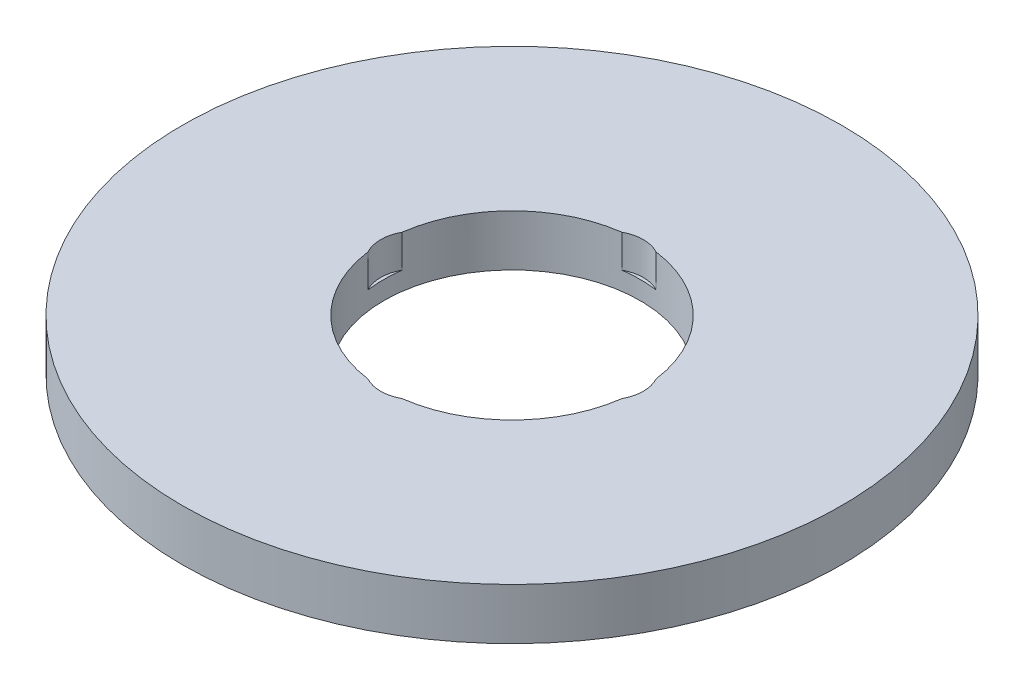
from build123d import *

# Parameters (mm, degrees)
SKETCH1_R           = 90
BOSS_EXTRUDE1_DEPTH = 14
SKETCH2_R           = 35
CUT_EXTRUDE1_DEPTH  = 129.04686642
SKETCH3_R           = 9.872665874
CUT_EXTRUDE2_DEPTH  = 8.971888535
CIRPATTERN1_COUNT   = 4


with BuildPart() as part:
    # Sketch1 → Boss-Extrude1 (new body)
    with BuildSketch(Plane(origin=(0, 0, 0), x_dir=(1, 0, 0), z_dir=(0, 1, 0))):
        Circle(SKETCH1_R)
    extrude(amount=BOSS_EXTRUDE1_DEPTH)

    # Sketch2 → Cut-Extrude1 (cut, through all)
    with BuildSketch(Plane(origin=(0, 0, 0), x_dir=(1, 0, 0), z_dir=(0, 1, 0))):
        Circle(SKETCH2_R)
    extrude(amount=CUT_EXTRUDE1_DEPTH, mode=Mode.SUBTRACT)

    # Sketch3 → Cut-Extrude2 (cut)
    with BuildSketch(Plane(origin=(0, 14, 0), x_dir=(1, 0, 0), z_dir=(0, 1, 0))):
        with Locations((-25.993402963, 0)):
            Circle(SKETCH3_R)
    cut_extrude2 = extrude(amount=-CUT_EXTRUDE2_DEPTH, mode=Mode.SUBTRACT)

    # CirPattern1: Cut-Extrude2 ×4 about axis
    cirpattern1_axis = Axis((0, 0, 0), (0, 1, 0))
    for i in range(1, CIRPATTERN1_COUNT):
        add(cut_extrude2.rotate(cirpattern1_axis, i * 360 / CIRPATTERN1_COUNT), mode=Mode.SUBTRACT)


solid = part.part
